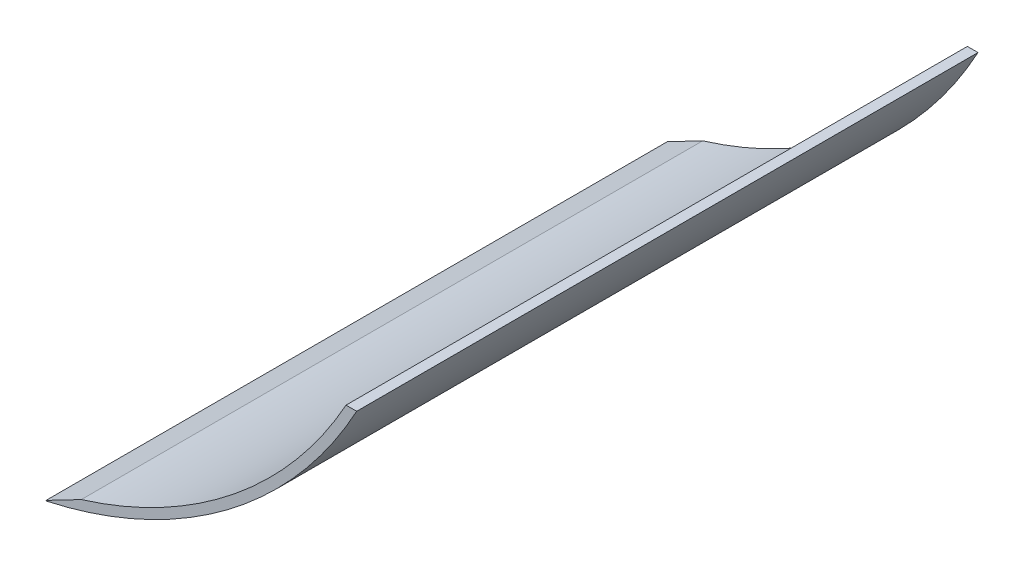
from build123d import *

# Parameters (mm, degrees)
BOSS_EXTRUDE1_DEPTH = 200
CHAMFER1_SIZE       = 2.917865617


with BuildPart() as part:
    # Sketch1 → Boss-Extrude1 (new body)
    with BuildSketch(Plane.XY):
        with BuildLine():
            Line((100, 75), (96.575796241, 75))
            ThreePointArc((96.575796241, 75), (55.991051333, 28.692941942), (0, 3.071323807))
            Line((0, 3.071323807), (0, 0))
            ThreePointArc((0, 0), (58.18465914, 26.587121146), (100, 75))
        make_face()
    extrude(amount=BOSS_EXTRUDE1_DEPTH)

    # Chamfer1
    # the kernel refuses this chamfer: 10, 2.917865617 mm, written as the material it takes off along each edge
    with BuildSketch(Plane(origin=(0, 3.071323807, -30.394078092), x_dir=(0.9668531761663356, 0.25533298991134823, 0), z_dir=(0, 0, 1))) as chamfer1_piece_1:
        with BuildLine():
            Line((11.767108546, 0), (-CHAMFER1_SIZE * 0.255332989918, -CHAMFER1_SIZE * 0.96685317619))
            Line((-CHAMFER1_SIZE * 0.255332989918, -CHAMFER1_SIZE * 0.96685317619), (0, 0))
            ThreePointArc((0, 0), (6.078871228, -0.117659648), (11.767108546, 0))
        make_face()
    extrude(amount=260.788156184, mode=Mode.SUBTRACT)


solid = part.part
